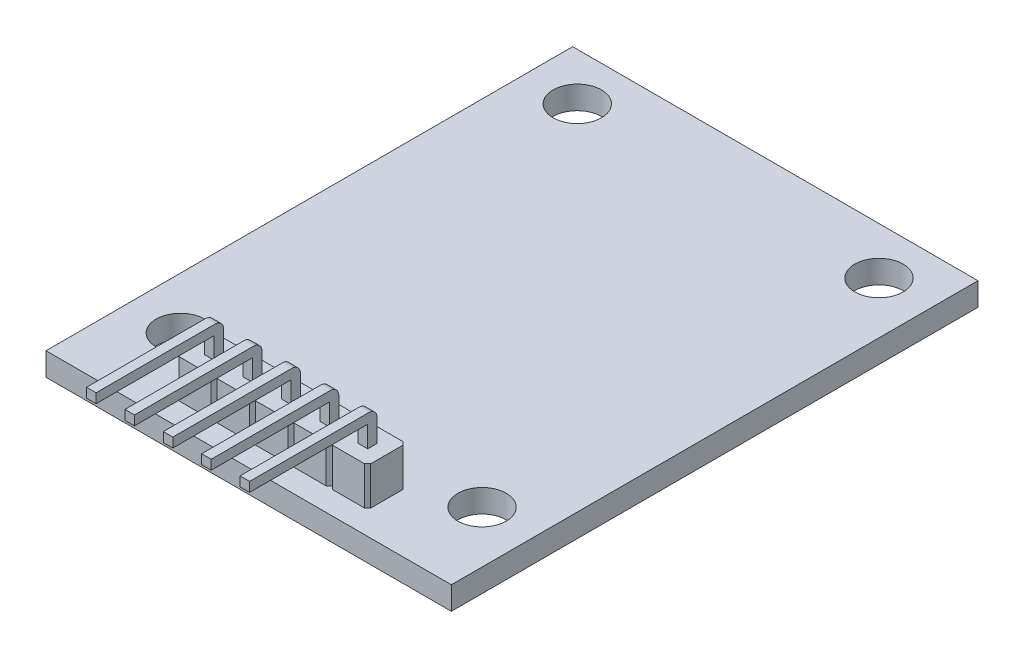
from build123d import *

# Parameters (mm, degrees)
SKETCH1_W           = 26.4
SKETCH1_H           = 34.3
SKETCH1_R           = 1.575
BOSS_EXTRUDE1_DEPTH = 1.5
SKETCH3_W           = 12.5
SKETCH3_H           = 2.5
BOSS_EXTRUDE2_DEPTH = 2.5
SWEEP3_START        = 7.89
SWEEP3_DEPTH        = 0.62
LPATTERN1_COUNT     = 5
LPATTERN1_PITCH     = 2.5
CUT_EXTRUDE1_DEPTH  = 2.5
CHAMFER1_SIZE       = 0.2


# Read off the part's stored shape, not the designer's step: Sweep3
with BuildPart() as part:
    # Sketch1 → Boss-Extrude1 (new body)
    with BuildSketch(Plane(origin=(0, 0, 0), x_dir=(1, 0, 0), z_dir=(0, 1, 0))):
        with Locations((13.2, 17.15)):
            Rectangle(SKETCH1_W, SKETCH1_H)
        with Locations(Location((3.375, 31.225, 0), (0, 0, 270))):
            Circle(SKETCH1_R, mode=Mode.SUBTRACT)
        with Locations(Location((23.025, 31.225, 0), (0, 0, 270))):
            Circle(SKETCH1_R, mode=Mode.SUBTRACT)
        with Locations(Location((23.025, 5.375, 0), (0, 0, 270))):
            Circle(SKETCH1_R, mode=Mode.SUBTRACT)
        with Locations(Location((3.375, 5.375, 0), (0, 0, 270))):
            Circle(SKETCH1_R, mode=Mode.SUBTRACT)
    extrude(amount=BOSS_EXTRUDE1_DEPTH)

    # Sketch3 → Boss-Extrude2 (add)
    with BuildSketch(Plane(origin=(0, 1.5, 0), x_dir=(1, 0, 0), z_dir=(0, 1, 0))):
        with Locations((13.2, 2.75)):
            Rectangle(SKETCH3_W, SKETCH3_H)
    extrude(amount=BOSS_EXTRUDE2_DEPTH)

    # Sweep3 outline → Sweep3 (add)
    with BuildSketch(Plane.YZ.offset(SWEEP3_START)):
        with BuildLine():
            Line((4, -2.44), (4, -3.06))
            add(Edge.make_bspline(
                [(4, -3.06), (4.241666667, -3.06), (4.483333333, -3.06), (4.845833333, -3.06), (4.966666667, -3.06), (5.147916667, -3.06), (5.208333333, -3.06), (5.298958333, -3.06), (5.329166667, -3.06), (5.389583333, -3.06), (5.401070283, -3.060067636), (5.503005944, -3.05992673), (5.595306319, -3.045739717), (5.730552262, -2.99013888), (5.793507671, -2.948451924), (5.898451924, -2.843507671), (5.94013888, -2.780552262), (5.995739717, -2.645306319), (6.00992673, -2.553005944), (6.010045188, -2.467309888), (6.01, -2.459635417), (6.01, -2.419270833), (6.01, -2.399088542), (6.01, -2.338541667), (6.01, -2.298177083), (6.01, -2.177083333), (6.01, -2.096354167), (6.01, -1.854166667), (6.01, -1.692708333), (6.01, -1.208333333), (6.01, -0.885416667), (6.01, 0.083333333), (6.01, 0.729166667), (6.01, 2.666666667), (6.01, 3.958333333), (6.01, 5.25)],
                knots=[0, 0, 0, 0, 0.075578312, 0.075578312, 0.113367467, 0.113367467, 0.132262045, 0.132262045, 0.141709334, 0.141709334, 0.151156623, 0.151156623, 0.161390945, 0.161390945, 0.171625267, 0.171625267, 0.181859589, 0.181859589, 0.192093911, 0.192093911, 0.198405677, 0.198405677, 0.204717443, 0.204717443, 0.217340976, 0.217340976, 0.242588041, 0.242588041, 0.293082172, 0.293082172, 0.394070433, 0.394070433, 0.596046955, 0.596046955, 1, 1, 1, 1], degree=3))
            Line((6.01, 5.25), (5.39, 5.25))
            Line((5.39, 5.25), (5.389999999, -2.440036459))
            Line((5.389999999, -2.440036459), (4, -2.44))
        make_face()
    sweep3 = extrude(amount=SWEEP3_DEPTH)

    # LPattern1: Sweep3 ×5
    with Locations(*[(i * LPATTERN1_PITCH, 0, 0) for i in range(1, LPATTERN1_COUNT)]):
        add(sweep3)

    # Sketch13 → Cut-Extrude1 (cut)
    with BuildSketch(Plane(origin=(0, 4, 0), x_dir=(1, 0, 0), z_dir=(0, 1, 0))):
        Polygon((11.95, 1.7), (11.75, 1.5), (12.15, 1.5), align=None)
        Polygon((16.75, 4), (16.95, 3.8), (17.15, 4), align=None)
        Polygon((14.45, 3.8), (14.65, 4), (14.25, 4), align=None)
        Polygon((9.45, 3.8), (9.65, 4), (9.25, 4), align=None)
        Polygon((9.25, 1.5), (9.45, 1.7), (9.65, 1.5), align=None)
        Polygon((14.45, 1.7), (14.65, 1.5), (14.25, 1.5), align=None)
        Polygon((16.75, 1.5), (17.15, 1.5), (16.95, 1.7), align=None)
        Polygon((12.15, 4), (11.75, 4), (11.95, 3.8), align=None)
    extrude(amount=-CUT_EXTRUDE1_DEPTH, mode=Mode.SUBTRACT)

    # Chamfer1
    chamfer1_edges = [part.edges().sort_by_distance(p)[0] for p in [
        (6.95, 2.75, -4),
        (6.95, 2.75, -1.5),
        (19.45, 2.75, -1.5),
        (19.45, 2.75, -4),
    ]]
    chamfer(chamfer1_edges, length=CHAMFER1_SIZE)


solid = part.part
